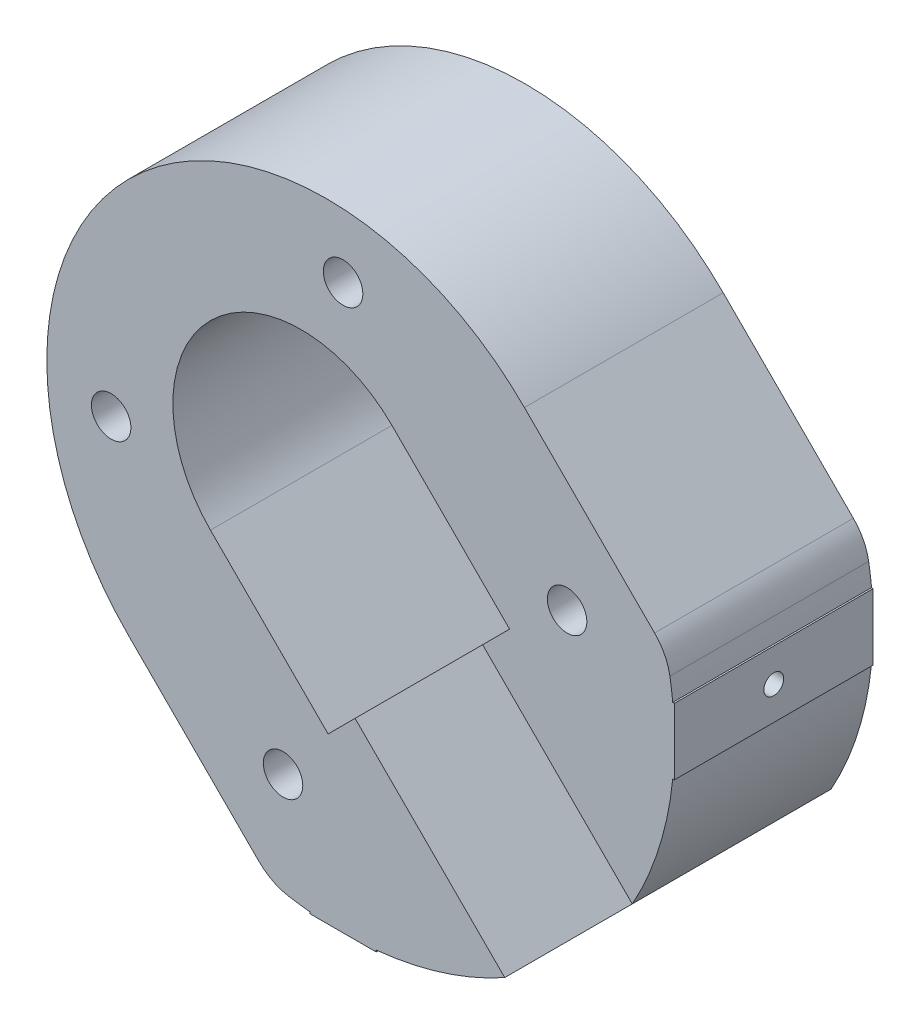
from build123d import *

# Parameters (mm, degrees)
BOSS_EXTRUDE1_DEPTH      = 15
BOSS_EXTRUDE1_DEPTH_BACK = 15
SKETCH2_R                = 1.5
CUT_EXTRUDE1_DEPTH       = 24
SKETCH3_R                = 1.5
CUT_EXTRUDE2_DEPTH       = 24
SKETCH6_R                = 2.9765625
CUT_EXTRUDE4_DEPTH       = 73.284161474


with BuildPart() as part:
    # Sketch1 → Boss-Extrude1 (new, two sides: drawn at the far end of the back side and taken through both)
    with BuildSketch(Plane.XY.offset(-BOSS_EXTRUDE1_DEPTH_BACK)):
        with BuildLine():
            Line((5, -50), (-5, -50))
            Line((-5, -50), (-5, -49.749371855))
            ThreePointArc((-5, -49.749371855), (-6.608385874, -49.561368384), (-8.209840211, -49.321379986))
            ThreePointArc((-8.209840211, -49.321379986), (-10.634728593, -48.517643399), (-12.698502349, -47.012015938))
            Line((-12.698502349, -47.012015938), (-32.34439039, -27.366127897))
            ThreePointArc((-32.34439039, -27.366127897), (-32.34439039, 32.34439039), (27.366127897, 32.34439039))
            Line((27.366127897, 32.34439039), (47.012015938, 12.698502349))
            ThreePointArc((47.012015938, 12.698502349), (48.517643399, 10.634728593), (49.321379986, 8.209840211))
            ThreePointArc((49.321379986, 8.209840211), (49.561368384, 6.608385874), (49.749371855, 5))
            Line((49.749371855, 5), (50, 5))
            Line((50, 5), (50, -5))
            Line((50, -5), (49.749371855, -5))
            ThreePointArc((49.749371855, -5), (47.693226632, -15.01186642), (43.64416838, -24.396445775))
            Line((43.64416838, -24.396445775), (21.058019947, -1.810297342))
            Line((21.058019947, -1.810297342), (25.128673235, 2.260355947))
            Line((25.128673235, 2.260355947), (7.371511647, 20.017517534))
            ThreePointArc((7.371511647, 20.017517534), (-20.017517534, 20.017517534), (-20.017517534, -7.371511647))
            Line((-20.017517534, -7.371511647), (-2.260355947, -25.128673235))
            Line((-2.260355947, -25.128673235), (1.810297342, -21.058019947))
            Line((1.810297342, -21.058019947), (24.396445775, -43.64416838))
            ThreePointArc((24.396445775, -43.64416838), (15.01186642, -47.693226632), (5, -49.749371855))
            Line((5, -49.749371855), (5, -50))
        make_face()
    extrude(amount=BOSS_EXTRUDE1_DEPTH + BOSS_EXTRUDE1_DEPTH_BACK)

    # Sketch2 → Cut-Extrude1 (cut)
    with BuildSketch(Plane(origin=(0, -50, 0), x_dir=(1, 0, 0), z_dir=(0, 1, 0))):
        Circle(SKETCH2_R)
    extrude(amount=CUT_EXTRUDE1_DEPTH, mode=Mode.SUBTRACT)

    # Sketch3 → Cut-Extrude2 (cut)
    with BuildSketch(Plane(origin=(50, 0, 0), x_dir=(0, 0, -1), z_dir=(1, 0, 0))):
        Circle(SKETCH3_R)
    extrude(amount=-CUT_EXTRUDE2_DEPTH, mode=Mode.SUBTRACT)

    # Sketch6 → Cut-Extrude4 (cut, through all)
    with BuildSketch(Plane.XY):
        with Locations((-9.058666579, -33.80740392)):
            Circle(SKETCH6_R)
        with Locations((-35, 0)):
            Circle(SKETCH6_R)
        with Locations((0, 35)):
            Circle(SKETCH6_R)
        with Locations((33.80740392, 9.058666579)):
            Circle(SKETCH6_R)
    extrude(amount=CUT_EXTRUDE4_DEPTH, mode=Mode.SUBTRACT)


solid = part.part
